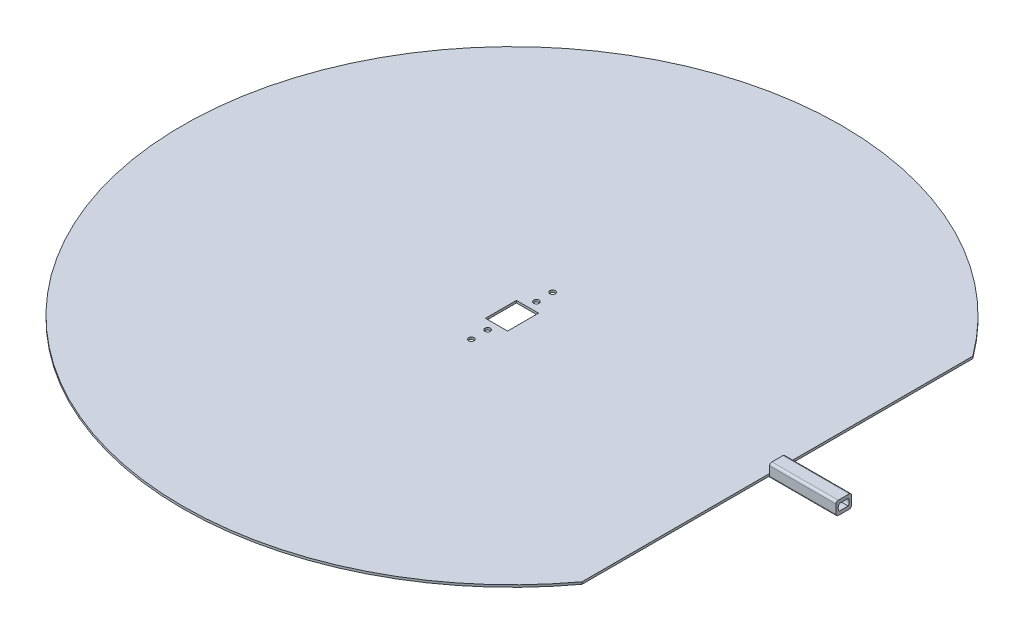
from build123d import *

# Parameters (mm, degrees)
ESQUISSE1_R             = 150
BOSS_EXTRU_1_DEPTH      = 2
ESQUISSE1_4_R           = 1.25
ENL_V_MAT_EXTRU_1_DEPTH = 1
ESQUISSE1_5_R           = 1.25
ENL_V_MAT_EXTRU_2_DEPTH = 13
BOSS_EXTRU_3_START      = 3
BOSS_EXTRU_3_DEPTH      = 3
BOSS_EXTRU_4_DEPTH      = 3
ENL_V_MAT_EXTRU_3_DEPTH = 50
CONG_1_R                = 1
ESQUISSE5_R             = 1
ENL_V_MAT_EXTRU_4_DEPTH = 180
ENL_V_MAT_EXTRU_5_DEPTH = 213.153246642
ESQUISSE7_W             = 7
ESQUISSE7_H             = 1
BOSS_EXTRU_5_DEPTH      = 20
CONG_3_R                = 1


with BuildPart() as part:
    # Esquisse1 → Boss.-Extru.1 (new body)
    with BuildSketch(Plane(origin=(0, 0, 0), x_dir=(1, 0, 0), z_dir=(0, 1, 0))):
        with Locations(Location((0, 0, 0), (0, 0, 270))):
            Circle(ESQUISSE1_R)
    extrude(amount=-BOSS_EXTRU_1_DEPTH)

    # Esquisse1<4> → Enlèv. mat.-Extru.1 (cut)
    with BuildSketch(Plane(origin=(0, 0, 0), x_dir=(1, 0, 0), z_dir=(0, 1, 0))):
        with BuildLine():
            Line((120, -88.323269867), (120, 88.323269867))
            ThreePointArc((120, 88.323269867), (-149, 0), (120, -88.323269867))
        make_face()
        with Locations(Location((0, -18.4, 0), (0, 0, 270))):
            Circle(ESQUISSE1_4_R, mode=Mode.SUBTRACT)
        with Locations(Location((0, -11, 0), (0, 0, 270))):
            Circle(ESQUISSE1_4_R, mode=Mode.SUBTRACT)
        Polygon((5, 7), (5, -6.999999465), (-5, -7), (-5.000000382, 7), align=None, mode=Mode.SUBTRACT)
        with Locations(Location((0, 11, 0), (0, 0, 270))):
            Circle(ESQUISSE1_4_R, mode=Mode.SUBTRACT)
        with Locations(Location((0, 18.4, 0), (0, 0, 270))):
            Circle(ESQUISSE1_4_R, mode=Mode.SUBTRACT)
    extrude(amount=-ENL_V_MAT_EXTRU_1_DEPTH, mode=Mode.SUBTRACT)

    # Esquisse1<5> → Enlèv. mat.-Extru.2 (cut)
    with BuildSketch(Plane(origin=(0, 0, 0), x_dir=(1, 0, 0), z_dir=(0, 1, 0))):
        Polygon((5, -6.999999465), (5, 7), (-5.000000382, 7), (-5, -7), align=None)
        with Locations(Location((0, -11, 0), (0, 0, 270))):
            Circle(ESQUISSE1_5_R)
        with Locations(Location((0, -18.4, 0), (0, 0, 270))):
            Circle(ESQUISSE1_5_R)
        with Locations(Location((0, 11, 0), (0, 0, 270))):
            Circle(ESQUISSE1_5_R)
        with Locations(Location((0, 18.4, 0), (0, 0, 270))):
            Circle(ESQUISSE1_5_R)
    extrude(amount=-ENL_V_MAT_EXTRU_2_DEPTH, mode=Mode.SUBTRACT)

    # Esquisse3 → Boss.-Extru.3 (add)
    with BuildSketch(Plane(origin=(0, 0, 0), x_dir=(1, 0, 0), z_dir=(0, 1, 0)).offset(BOSS_EXTRU_3_START)):
        with BuildLine():
            Line((120, -3.5), (149.959161107, -3.5))
            ThreePointArc((149.959161107, -3.5), (149.989789929, -1.750119126), (150, 0))
            ThreePointArc((150, 0), (149.989789929, 1.750119126), (149.959161107, 3.5))
            Line((149.959161107, 3.5), (120, 3.5))
            Line((120, 3.5), (120, -3.5))
        make_face()
    extrude(amount=-BOSS_EXTRU_3_DEPTH)

    # Esquisse3<2> → Boss.-Extru.4 (add)
    with BuildSketch(Plane(origin=(0, 0, 0), x_dir=(1, 0, 0), z_dir=(0, 1, 0))):
        with BuildLine():
            Line((120, -3.5), (149.959161107, -3.5))
            ThreePointArc((149.959161107, -3.5), (149.989789929, -1.750119126), (150, 0))
            ThreePointArc((150, 0), (149.989789929, 1.750119126), (149.959161107, 3.5))
            Line((149.959161107, 3.5), (120, 3.5))
            Line((120, 3.5), (120, -3.5))
        make_face()
    extrude(amount=-BOSS_EXTRU_4_DEPTH)

    # Esquisse4 → Enlèv. mat.-Extru.3 (cut)
    with BuildSketch(Plane(origin=(120, 0, 0), x_dir=(0, 0, -1), z_dir=(1, 0, 0))):
        with BuildLine():
            Line((-2, 1.5), (2, 1.5))
            ThreePointArc((2, 1.5), (2.5, 0), (2, -1.5))
            Line((2, -1.5), (-2, -1.5))
            ThreePointArc((-2, -1.5), (-2.5, 0), (-2, 1.5))
        make_face()
    extrude(amount=ENL_V_MAT_EXTRU_3_DEPTH, mode=Mode.SUBTRACT)

    # Congé1
    cong_1_edges = [part.edges().sort_by_distance(p)[0] for p in [
        (134.979580554, -3, -3.5),
        (134.979580554, -3, 3.5),
        (134.979580554, 3, 3.5),
        (134.979580554, 3, -3.5),
    ]]
    fillet(cong_1_edges, radius=CONG_1_R - 0.0001)  # a hair under: the kernel refuses the full size

    # Esquisse5 → Enlèv. mat.-Extru.4 (cut)
    with BuildSketch(Plane(origin=(0, 0, 0), x_dir=(0, 0, -1), z_dir=(1, 0, 0))):
        Circle(ESQUISSE5_R)
    extrude(amount=-ENL_V_MAT_EXTRU_4_DEPTH, mode=Mode.SUBTRACT)

    # Esquisse3<4> → Enlèv. mat.-Extru.5 (cut, through all)
    with BuildSketch(Plane(origin=(0, 0, 0), x_dir=(1, 0, 0), z_dir=(0, 1, 0))):
        with BuildLine():
            ThreePointArc((149.959161107, 3.5), (-150, 0), (149.959161107, -3.5))
            Line((149.959161107, -3.5), (120, -3.5))
            Line((120, -3.5), (120, -88.323269867))
            ThreePointArc((120, -88.323269867), (-149, 0), (120, 88.323269867))
            Line((120, 88.323269867), (120, 3.5))
            Line((120, 3.5), (149.959161107, 3.5))
        make_face()
    extrude(amount=-ENL_V_MAT_EXTRU_5_DEPTH, mode=Mode.SUBTRACT)

    # Esquisse7 → Boss.-Extru.5 (add)
    with BuildSketch(Plane.ZY.offset(-120)):
        with Locations((0, -2.5)):
            Rectangle(ESQUISSE7_W, ESQUISSE7_H)
    extrude(amount=BOSS_EXTRU_5_DEPTH)

    # Congé3
    cong_3_edges = [part.edges().sort_by_distance(p)[0] for p in [
        (100, -3, 0),
        (110, -3, -3.5),
        (110, -3, 3.5),
    ]]
    fillet(cong_3_edges, radius=CONG_3_R - 0.0001)  # a hair under: the kernel refuses the full size


solid = part.part
